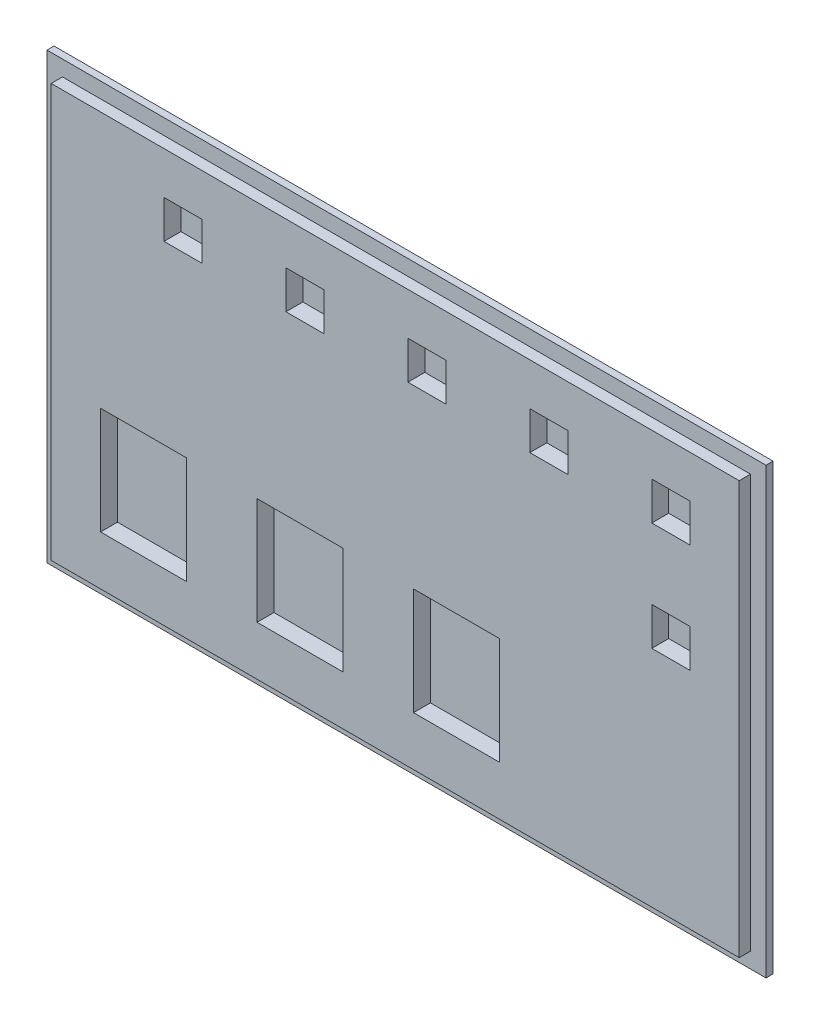
from build123d import *

# Parameters (mm, degrees)
SKICA1_W                = 97.6
SKICA1_H                = 58.6
SKICA1_W_2              = 12.2
SKICA1_H_2              = 15.2
SKICA1_W_3              = 5.4
SKICA1_H_3              = 5.4
P_IDAT_VYSUNUT_M1_DEPTH = 2.6
SKICA1_3_W              = 102
SKICA1_3_H              = 63
SKICA1_3_W_2            = 97.6
SKICA1_3_H_2            = 58.6
P_IDAT_VYSUNUT_M2_DEPTH = 1
SKICA1_5_W              = 5.4
SKICA1_5_H              = 5.4
SKICA1_5_W_2            = 12.2
SKICA1_5_H_2            = 15.2
P_IDAT_VYSUNUT_M3_DEPTH = 0.2


with BuildPart() as part:
    # Skica1 → Přidat vysunutím1 (new body)
    with BuildSketch(Plane.XY):
        with Locations((51, 31.5)):
            Rectangle(SKICA1_W, SKICA1_H)
        with Locations((15.3, 16.8)):
            Rectangle(SKICA1_W_2, SKICA1_H_2, mode=Mode.SUBTRACT)
        with Locations((37.5, 16.8)):
            Rectangle(SKICA1_W_2, SKICA1_H_2, mode=Mode.SUBTRACT)
        with Locations((59.7, 16.8)):
            Rectangle(SKICA1_W_2, SKICA1_H_2, mode=Mode.SUBTRACT)
        with Locations((20.9, 52.1)):
            Rectangle(SKICA1_W_3, SKICA1_H_3, mode=Mode.SUBTRACT)
        with Locations((38.2, 52.1)):
            Rectangle(SKICA1_W_3, SKICA1_H_3, mode=Mode.SUBTRACT)
        with Locations((90.1, 36.7)):
            Rectangle(SKICA1_W_3, SKICA1_H_3, mode=Mode.SUBTRACT)
        with Locations((55.5, 52.1)):
            Rectangle(SKICA1_W_3, SKICA1_H_3, mode=Mode.SUBTRACT)
        with Locations((72.8, 52.1)):
            Rectangle(SKICA1_W_3, SKICA1_H_3, mode=Mode.SUBTRACT)
        with Locations((90.1, 52.1)):
            Rectangle(SKICA1_W_3, SKICA1_H_3, mode=Mode.SUBTRACT)
    extrude(amount=P_IDAT_VYSUNUT_M1_DEPTH)

    # Skica1<3> → Přidat vysunutím2 (add)
    with BuildSketch(Plane.XY):
        with Locations((51, 31.5)):
            Rectangle(SKICA1_3_W, SKICA1_3_H)
        with Locations((51, 31.5)):
            Rectangle(SKICA1_3_W_2, SKICA1_3_H_2, mode=Mode.SUBTRACT)
    extrude(amount=P_IDAT_VYSUNUT_M2_DEPTH)

    # Skica1<5> → Přidat vysunutím3 (add)
    with BuildSketch(Plane.XY):
        with Locations((20.9, 52.1)):
            Rectangle(SKICA1_5_W, SKICA1_5_H)
        with Locations((38.2, 52.1)):
            Rectangle(SKICA1_5_W, SKICA1_5_H)
        with Locations((55.5, 52.1)):
            Rectangle(SKICA1_5_W, SKICA1_5_H)
        with Locations((72.8, 52.1)):
            Rectangle(SKICA1_5_W, SKICA1_5_H)
        with Locations((90.1, 52.1)):
            Rectangle(SKICA1_5_W, SKICA1_5_H)
        with Locations((15.3, 16.8)):
            Rectangle(SKICA1_5_W_2, SKICA1_5_H_2)
        with Locations((37.5, 16.8)):
            Rectangle(SKICA1_5_W_2, SKICA1_5_H_2)
        with Locations((59.7, 16.8)):
            Rectangle(SKICA1_5_W_2, SKICA1_5_H_2)
        with Locations((90.1, 36.7)):
            Rectangle(SKICA1_5_W, SKICA1_5_H)
    extrude(amount=P_IDAT_VYSUNUT_M3_DEPTH)


solid = part.part
